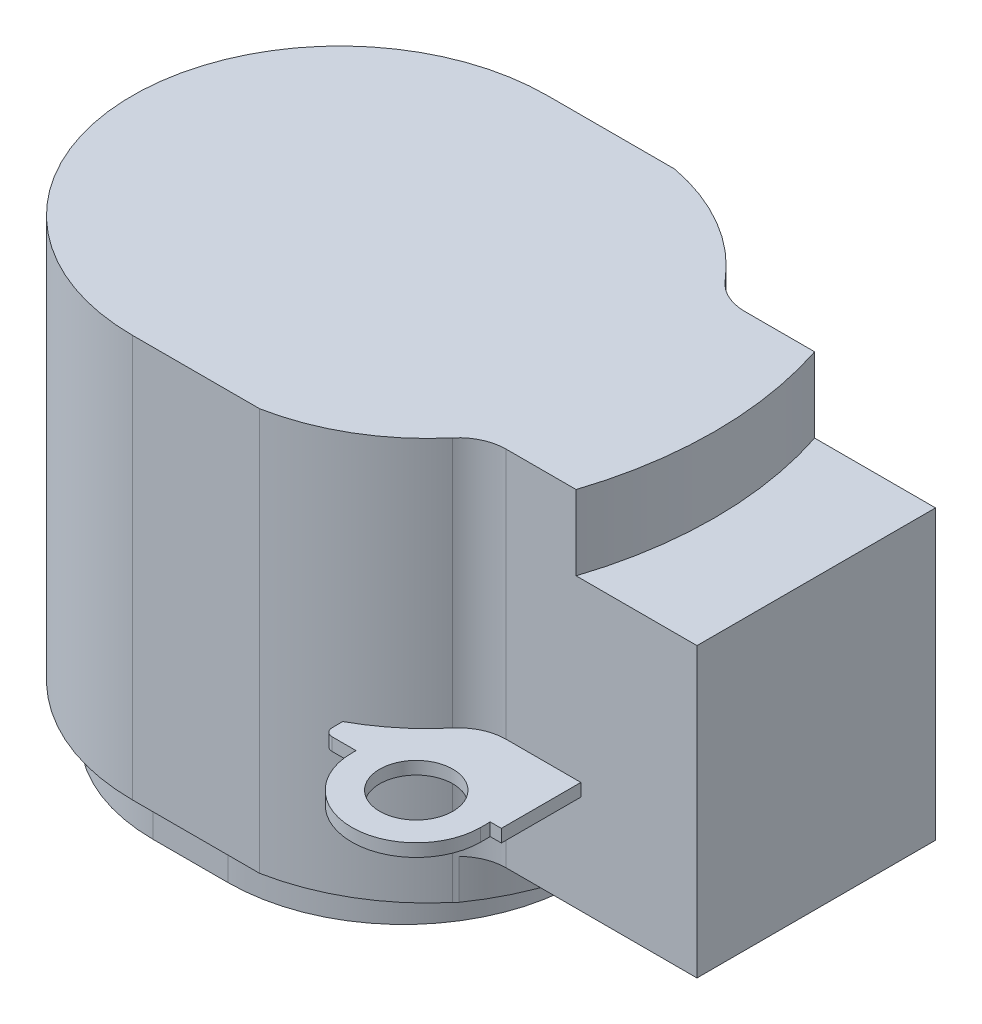
from build123d import *

# Parameters (mm, degrees)
BOSS_EXTRUDE1_DEPTH = 28.8
CUT_EXTRUDE1_DEPTH  = 41.90409515
BOSS_EXTRUDE3_DEPTH = 1
CUT_EXTRUDE2_DEPTH  = 4.7
SKETCH4_R           = 2.3
BOSS_EXTRUDE2_DEPTH = 0.8
SKETCH5_OUTSIDE_W   = 57.418
SKETCH5_OUTSIDE_H   = 48.718
CUT_EXTRUDE3_DEPTH  = 3.5
SKETCH6_OUTSIDE_W   = 57.418
SKETCH6_OUTSIDE_H   = 48.718
CUT_EXTRUDE4_DEPTH  = 2.5
SKETCH8_W           = 6.84
SKETCH8_H           = 4.95
BOSS_EXTRUDE4_DEPTH = 25


with BuildPart() as part:
    # Sketch1 → Boss-Extrude1 (new body)
    with BuildSketch(Plane(origin=(0, 0, 0), x_dir=(1, 0, 0), z_dir=(0, 1, 0))):
        with BuildLine():
            Line((-4, 13.05), (4, 13.05))
            ThreePointArc((4, 13.05), (8.213640499, 11.465985784), (11.656602829, 8.566006872))
            ThreePointArc((11.656602829, 8.566006872), (12.685480206, 7.779523995), (13.95, 7.5))
            Line((13.95, 7.5), (25.95, 7.5))
            Line((25.95, 7.5), (25.95, -7.5))
            Line((25.95, -7.5), (13.95, -7.5))
            ThreePointArc((13.95, -7.5), (12.685480206, -7.779523995), (11.656602829, -8.566006872))
            ThreePointArc((11.656602829, -8.566006872), (8.213640499, -11.465985784), (4, -13.05))
            Line((4, -13.05), (-4, -13.05))
            ThreePointArc((-4, -13.05), (-17.05, 0), (-4, 13.05))
        make_face()
    extrude(amount=-BOSS_EXTRUDE1_DEPTH)

    # Sketch2 → Cut-Extrude1 (cut, through all)
    with BuildSketch(Plane(origin=(0, 0, 0), x_dir=(1, 0, 0), z_dir=(0, 1, 0))):
        with BuildLine():
            Line((0, -9.05), (-4.7, -9.05))
            ThreePointArc((-4.7, -9.05), (-13.75, 0), (-4.7, 9.05))
            Line((-4.7, 9.05), (0, 9.05))
            ThreePointArc((0, 9.05), (9.05, 0), (0, -9.05))
        make_face()
    extrude(amount=-CUT_EXTRUDE1_DEPTH, mode=Mode.SUBTRACT)

    # Sketch7 → Boss-Extrude3 (add)
    with BuildSketch(Plane(origin=(0, 0, 0), x_dir=(1, 0, 0), z_dir=(0, 1, 0))):
        with BuildLine():
            Line((-4.7, 10.05), (0, 10.05))
            ThreePointArc((0, 10.05), (10.05, 0), (0, -10.05))
            Line((0, -10.05), (-4.7, -10.05))
            ThreePointArc((-4.7, -10.05), (-14.75, 0), (-4.7, 10.05))
        make_face()
    extrude(amount=-BOSS_EXTRUDE3_DEPTH)

    # Sketch3 → Cut-Extrude2 (cut)
    with BuildSketch(Plane(origin=(0, 0, 0), x_dir=(1, 0, 0), z_dir=(0, 1, 0))):
        with BuildLine():
            Line((25.95, 7.5), (18.35, 7.5))
            ThreePointArc((18.35, 7.5), (19.55, 0), (18.35, -7.5))
            Line((18.35, -7.5), (25.95, -7.5))
            Line((25.95, -7.5), (25.95, 7.5))
        make_face()
    extrude(amount=-CUT_EXTRUDE2_DEPTH, mode=Mode.SUBTRACT)

    # Sketch4 → Boss-Extrude2 (add)
    with BuildSketch(Plane(origin=(0, -15.8, 0), x_dir=(1, 0, 0), z_dir=(0, 1, 0))):
        with BuildLine():
            Line((17.95, 12.5), (17.95, 13.1))
            ThreePointArc((17.95, 13.1), (13.9, 17.15), (9.85, 13.1))
            Line((9.85, 13.1), (9.85, 12.835141167))
            Line((9.85, 12.835141167), (8.35, 12.835141167))
            ThreePointArc((8.35, 12.835141167), (7.996446609, 12.688694558), (7.85, 12.335141167))
            Line((7.85, 12.335141167), (7.85, 10.106704765))
            Line((7.85, 10.106704765), (9.85, 10.106704765))
            Line((9.85, 10.106704765), (9.85, -10.106704765))
            Line((9.85, -10.106704765), (7.85, -10.106704765))
            Line((7.85, -10.106704765), (7.85, -12.335141167))
            ThreePointArc((7.85, -12.335141167), (7.996446609, -12.688694558), (8.35, -12.835141167))
            Line((8.35, -12.835141167), (9.85, -12.835141167))
            Line((9.85, -12.835141167), (9.85, -13.1))
            ThreePointArc((9.85, -13.1), (13.9, -17.15), (17.95, -13.1))
            Line((17.95, -13.1), (17.95, -12.5))
            Line((17.95, -12.5), (18.65, -12.5))
            Line((18.65, -12.5), (18.65, -6.668963251))
            Line((18.65, -6.668963251), (17.95, -6.668963251))
            Line((17.95, -6.668963251), (17.95, 6.668963251))
            Line((17.95, 6.668963251), (18.65, 6.668963251))
            Line((18.65, 6.668963251), (18.65, 12.5))
            Line((18.65, 12.5), (17.95, 12.5))
        make_face()
        with Locations((13.9, -13.1)):
            Circle(SKETCH4_R, mode=Mode.SUBTRACT)
        with Locations((13.9, 13.1)):
            Circle(SKETCH4_R, mode=Mode.SUBTRACT)
    extrude(amount=-BOSS_EXTRUDE2_DEPTH)

    # Sketch5 outside → Cut-Extrude3 (cut)
    # profile 1 of 2: a face of its own
    with BuildSketch(Plane.XZ.offset(28.8)):
        with Locations((4.45, 0)):
            Rectangle(SKETCH5_OUTSIDE_W, SKETCH5_OUTSIDE_H)
        with BuildLine():
            Line((0, 11.05), (-4.7, 11.05))
            ThreePointArc((-4.7, 11.05), (-15.75, 0), (-4.7, -11.05))
            Line((-4.7, -11.05), (0, -11.05))
            ThreePointArc((0, -11.05), (11.05, 0), (0, 11.05))
        make_face(mode=Mode.SUBTRACT)
    # profile 2 of 2: a face of its own
    with BuildSketch(Plane.XZ.offset(28.8)):
        with BuildLine():
            Line((-4.7, 9.05), (0, 9.05))
            ThreePointArc((0, 9.05), (9.05, 0), (0, -9.05))
            Line((0, -9.05), (-4.7, -9.05))
            ThreePointArc((-4.7, -9.05), (-13.75, 0), (-4.7, 9.05))
        make_face()
    extrude(amount=-CUT_EXTRUDE3_DEPTH, mode=Mode.SUBTRACT)

    # Sketch6 outside → Cut-Extrude4 (cut)
    with BuildSketch(Plane.XZ.offset(25.3)):
        with Locations((4.45, 0)):
            Rectangle(SKETCH6_OUTSIDE_W, SKETCH6_OUTSIDE_H)
        with BuildLine():
            Line((-0.915214063, 14.471830711), (-20.749472671, 14.471830711))
            Line((-20.749472671, 14.471830711), (-20.749472671, -14.500741391))
            Line((-20.749472671, -14.500741391), (0, -14.500741391))
            ThreePointArc((0, -14.500741391), (14.493511919, 0.457835289), (-0.915214063, 14.471830711))
        make_face(mode=Mode.SUBTRACT)
    extrude(amount=-CUT_EXTRUDE4_DEPTH, mode=Mode.SUBTRACT)

    # Sketch8 → Boss-Extrude4 (add)
    with BuildSketch(Plane(origin=(25.95, 0, 0), x_dir=(0, 0, -1), z_dir=(1, 0, 0))):
        with Locations((0, -19.505)):
            Rectangle(SKETCH8_W, SKETCH8_H)
        with Locations((0, -8.555)):
            Rectangle(SKETCH8_W, SKETCH8_H)
    extrude(amount=-BOSS_EXTRUDE4_DEPTH)


solid = part.part
